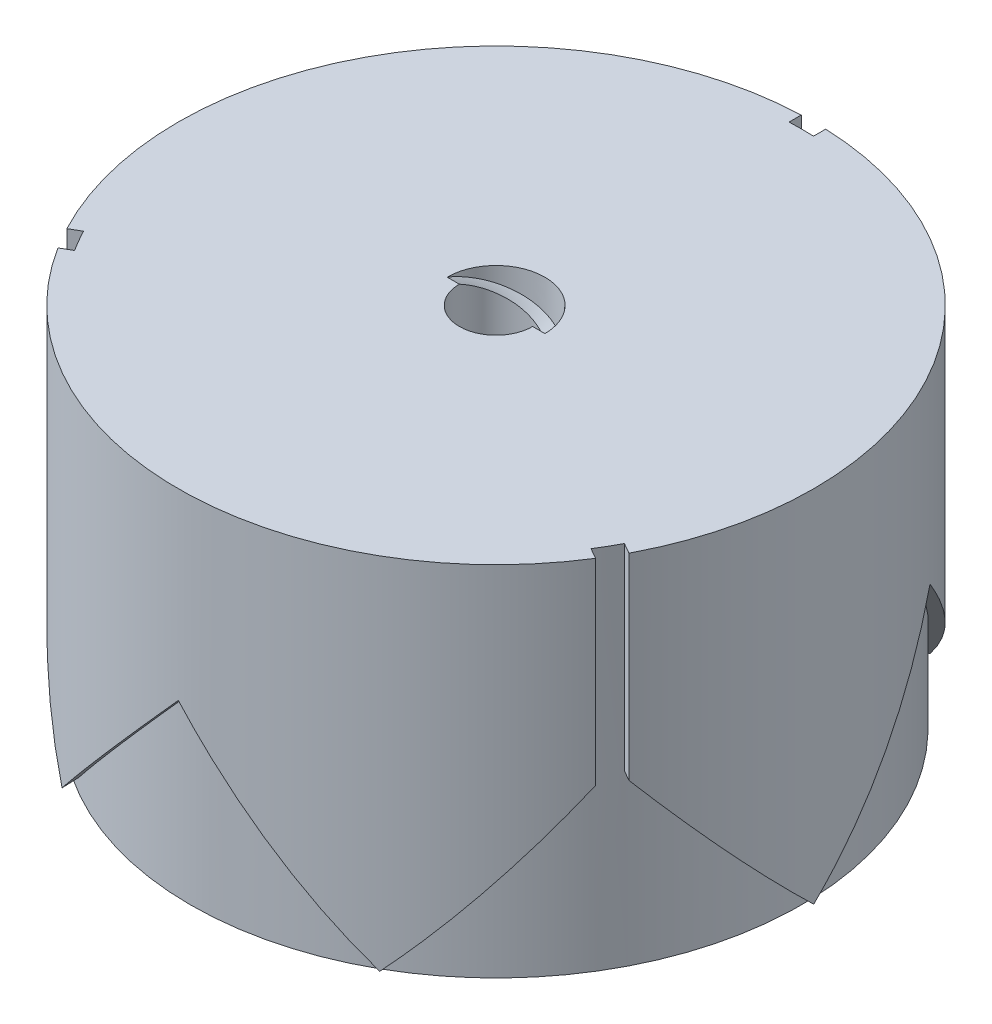
from build123d import *

# Parameters (mm, degrees)
SKETCH1_R           = 13
BOSS_EXTRUDE1_DEPTH = 15
CUT_EXTRUDE2_DEPTH  = 15
CIRPATTERN1_COUNT   = 3
CUT_EXTRUDE3_DEPTH  = 39.509739028
CIRPATTERN2_COUNT   = 3
BOSS_EXTRUDE2_START = 10
SKETCH7_R           = 12.5
BOSS_EXTRUDE2_DEPTH = 10
SKETCH2_R           = 1.5
CUT_EXTRUDE1_DEPTH  = 15
CUT_SWEEP2_PITCH    = 5
SCALE1_SCALE        = 0.655


with BuildPart() as part:
    # Sketch1 → Boss-Extrude1 (new body)
    with BuildSketch(Plane(origin=(0, 0, 0), x_dir=(1, 0, 0), z_dir=(0, 1, 0))):
        with Locations(Location((0, 0, 0), (0, 0, 270))):
            Circle(SKETCH1_R)
    extrude(amount=BOSS_EXTRUDE1_DEPTH)

    # Sketch5 → Cut-Extrude2 (cut)
    with BuildSketch(Plane(origin=(0, 15, 0), x_dir=(1, 0, 0), z_dir=(0, 1, 0))):
        with BuildLine():
            Line((-0.5, 16.655211935), (0.5, 16.655211935))
            Line((0.5, 16.655211935), (0.5, 12.489995997))
            ThreePointArc((0.5, 12.489995997), (0, 12.5), (-0.5, 12.489995997))
            Line((-0.5, 12.489995997), (-0.5, 16.655211935))
        make_face()
    cut_extrude2 = extrude(amount=-CUT_EXTRUDE2_DEPTH, mode=Mode.SUBTRACT)

    # CirPattern1: Cut-Extrude2 ×3 about axis
    cirpattern1_axis = Axis((0, 0, 0), (0, 1, 0))
    for i in range(1, CIRPATTERN1_COUNT):
        add(cut_extrude2.rotate(cirpattern1_axis, i * 360 / CIRPATTERN1_COUNT), mode=Mode.SUBTRACT)

    # Sketch6 → Cut-Extrude3 (cut, symmetric)
    with BuildSketch(Plane.XY.offset(-20)):
        Polygon((0, 7.5), (-6.75, 0), (6.75, 0), align=None)
    cut_extrude3 = extrude(amount=CUT_EXTRUDE3_DEPTH, both=True, mode=Mode.SUBTRACT)

    # CirPattern2: Cut-Extrude3 ×3 about axis
    cirpattern2_axis = Axis((0, 0, 0), (0, 1, 0))
    for i in range(1, CIRPATTERN2_COUNT):
        add(cut_extrude3.rotate(cirpattern2_axis, i * 360 / CIRPATTERN2_COUNT), mode=Mode.SUBTRACT)

    # Sketch7 → Boss-Extrude2 (add)
    with BuildSketch(Plane(origin=(0, 0, 0), x_dir=(1, 0, 0), z_dir=(0, 1, 0)).offset(BOSS_EXTRUDE2_START)):
        with Locations(Location((0, 0, 0), (0, 0, 270))):
            Circle(SKETCH7_R)
    extrude(amount=-BOSS_EXTRUDE2_DEPTH)

    # Sketch2 → Cut-Extrude1 (cut)
    with BuildSketch(Plane(origin=(0, 15, 0), x_dir=(1, 0, 0), z_dir=(0, 1, 0))):
        with Locations(Location((0, 0, 0), (0, 0, 270))):
            Circle(SKETCH2_R)
    extrude(amount=-CUT_EXTRUDE1_DEPTH, mode=Mode.SUBTRACT)

    # Cut-Sweep2: arcs per turn and ends read off the stored shape
    # Cut-Sweep2: the profile of Sketch4 profile screwed along a right-hand helix through 4.5 turns, 12 arcs to a turn; built about Z, then put on its axis
    cut_sweep2_z = Axis((0, 0, 0), (0, 0, 1))
    cut_sweep2_corners = [(2, 0, -5), (1.4997, 0, -5), (1.4997, 0, -7.5), (2, 0, -7.5)]
    with BuildLine(mode=Mode.PRIVATE) as cut_sweep2_profile:
        Line(cut_sweep2_corners[0], cut_sweep2_corners[1])
        Line(cut_sweep2_corners[1], cut_sweep2_corners[2])
        Line(cut_sweep2_corners[2], cut_sweep2_corners[3])
        Line(cut_sweep2_corners[3], cut_sweep2_corners[0])
    cut_sweep2_cap = Face(cut_sweep2_profile.wire())
    cut_sweep2_turn_angles = [0, 15, 30, 45, 60, 75, 90, 105, 120, 135, 150, 165, 180, 195, 210, 225, 240, 255, 270, 285, 300, 315, 330, 345, 360]
    cut_sweep2_turn_weights = [1, 0.9659258262890683, 1, 0.9659258262890683, 1, 0.9659258262890683, 1, 0.9659258262890683, 1, 0.9659258262890683, 1, 0.9659258262890683, 1, 0.9659258262890683, 1, 0.9659258262890683, 1, 0.9659258262890683, 1, 0.9659258262890683, 1, 0.9659258262890683, 1, 0.9659258262890683, 1]
    cut_sweep2_turn_rails = [Edge.make_bspline([Vector(p[0], p[1], 0).rotate(cut_sweep2_z, cut_sweep2_turn_angles[k]) / cut_sweep2_turn_weights[k] + Vector(0, 0, p[2] + CUT_SWEEP2_PITCH * cut_sweep2_turn_angles[k] / 360) for k in range(25)], [0, 0, 0, 1, 1, 2, 2, 3, 3, 4, 4, 5, 5, 6, 6, 7, 7, 8, 8, 9, 9, 10, 10, 11, 11, 12, 12, 12], 2, cut_sweep2_turn_weights) for p in cut_sweep2_corners]
    cut_sweep2_turn_sides = [Face.make_surface_from_curves(cut_sweep2_turn_rails[p[0]], cut_sweep2_turn_rails[p[1]]) for p in [(0, 1), (1, 2), (2, 3), (3, 0)]]
    cut_sweep2_last_angles = [1440, 1455, 1470, 1485, 1500, 1515, 1530, 1545, 1560, 1575, 1590, 1605, 1620]
    cut_sweep2_last_weights = [1, 0.9659258262890683, 1, 0.9659258262890683, 1, 0.9659258262890683, 1, 0.9659258262890683, 1, 0.9659258262890683, 1, 0.9659258262890683, 1]
    cut_sweep2_last_rails = [Edge.make_bspline([Vector(p[0], p[1], 0).rotate(cut_sweep2_z, cut_sweep2_last_angles[k]) / cut_sweep2_last_weights[k] + Vector(0, 0, p[2] + CUT_SWEEP2_PITCH * cut_sweep2_last_angles[k] / 360) for k in range(13)], [0, 0, 0, 1, 1, 2, 2, 3, 3, 4, 4, 5, 5, 6, 6, 6], 2, cut_sweep2_last_weights) for p in cut_sweep2_corners]
    cut_sweep2_last_sides = [Face.make_surface_from_curves(cut_sweep2_last_rails[p[0]], cut_sweep2_last_rails[p[1]]) for p in [(0, 1), (1, 2), (2, 3), (3, 0)]]
    cut_sweep2 = Plane(origin=(0, 15, 0), x_dir=(-1, 0, 0), z_dir=(0, -1, 0)) * Solid(Shell([*[p.moved(Location((0, 0, CUT_SWEEP2_PITCH * i))) for i in range(4) for p in cut_sweep2_turn_sides], *cut_sweep2_last_sides, cut_sweep2_cap, cut_sweep2_cap.rotate(cut_sweep2_z, 1620).moved(Location((0, 0, CUT_SWEEP2_PITCH * 1620 / 360)))]))
    add(cut_sweep2, mode=Mode.SUBTRACT)


with BuildPart() as part_1:
    # Scale1: scaled about (0, 0, 0)
    add(part.part.scale(SCALE1_SCALE))


solid = part_1.part
